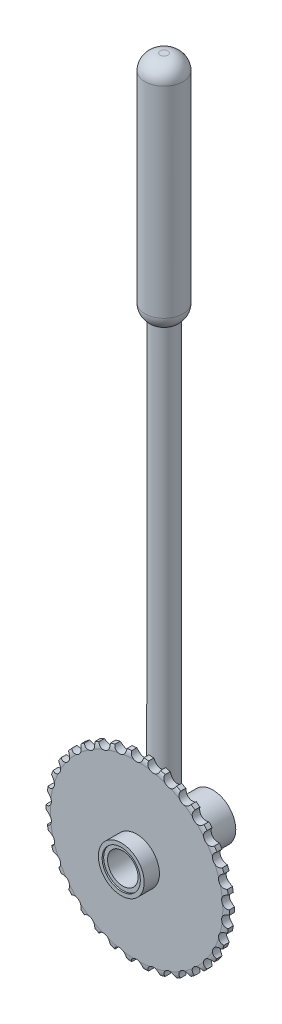
from build123d import *

# Parameters (mm, degrees)
SKETCH1_R           = 15
EXTRUDE1_DEPTH      = 60
SKETCH2_R           = 60
EXTRUDE2_DEPTH      = 5
SKETCH3_R           = 8
BOSS_EXTRUDE1_DEPTH = 449
SKETCH4_R           = 12.5
BOSS_EXTRUDE2_DEPTH = 150
FILLET2_R           = 10
FILLET3_R           = 10
SKETCH5_R           = 10
CUT_EXTRUDE1_DEPTH  = 60
SKETCH6_R           = 12.5
CUT_EXTRUDE2_DEPTH  = 1
SKETCH7_R           = 4
CUT_EXTRUDE3_DEPTH  = 5


with BuildPart() as part:
    # Sketch1 → Extrude1 (new body)
    with BuildSketch(Plane.XY):
        Circle(SKETCH1_R)
    extrude(amount=-EXTRUDE1_DEPTH)

    # Sketch2 → Extrude2 (add)
    with BuildSketch(Plane.XY.offset(-10)):
        Circle(SKETCH2_R)
    extrude(amount=-EXTRUDE2_DEPTH)

    # Sketch3 → Boss-Extrude1 (add)
    with BuildSketch(Plane(origin=(0, 0, 0), x_dir=(1, 0, 0), z_dir=(0, 1, 0))):
        with Locations(Location((0, 28, 0), (0, 0, 90))):
            Circle(SKETCH3_R)
    extrude(amount=BOSS_EXTRUDE1_DEPTH)

    # Sketch4 → Boss-Extrude2 (add)
    with BuildSketch(Plane(origin=(0, 449, 0), x_dir=(1, 0, 0), z_dir=(0, 1, 0))):
        with Locations(Location((0, 28, 0), (0, 0, 270))):
            Circle(SKETCH4_R)
    extrude(amount=-BOSS_EXTRUDE2_DEPTH)

    # Fillet2
    fillet2_edges = [part.edges().sort_by_distance(p)[0] for p in [
        (0, 449, -40.5),
    ]]
    fillet(fillet2_edges, radius=FILLET2_R)

    # Fillet3
    # the kernel refuses this fillet: 10 mm, written as the material it takes off along each edge
    with BuildSketch(Plane(origin=(0, 299, -28), x_dir=(0, 0, 1), z_dir=(-1, 0, 0))) as fillet3_piece_1:
        with BuildLine():
            CenterArc((2.5, 8.351646544), FILLET3_R, 303.367012969, 56.632987031)
            Line((8, 0), (8.11, -0.167032931))
            ThreePointArc((8.11, -0.167032931), (10.25, -0.2), (12.5, -0.2))
            Line((12.5, -0.2), (12.7, 0))
            Line((12.7, 0), (12.7, 8.351646544))
            Line((12.7, 8.351646544), (12.5, 8.351646544))
        make_face()
    revolve(axis=Axis((0, 299, -28), (0, 1, 0)), mode=Mode.SUBTRACT)

    # Sketch5 → Cut-Extrude1 (cut)
    with BuildSketch(Plane.XY):
        Circle(SKETCH5_R)
    extrude(amount=-CUT_EXTRUDE1_DEPTH, mode=Mode.SUBTRACT)

    # Sketch6 → Cut-Extrude2 (cut)
    with BuildSketch(Plane.XY):
        Circle(SKETCH6_R)
    extrude(amount=-CUT_EXTRUDE2_DEPTH, mode=Mode.SUBTRACT)

    # Sketch7 → Cut-Extrude3 (cut)
    with BuildSketch(Plane.XY.offset(-10)):
        with Locations((0, 60)):
            Circle(SKETCH7_R)
        with Locations((11.024971069, 58.978385981)):
            Circle(SKETCH7_R)
        with Locations((21.674499971, 55.948333764)):
            Circle(SKETCH7_R)
        with Locations((31.585929773, 51.013028144)):
            Circle(SKETCH7_R)
        with Locations((40.421738619, 44.340535033)):
            Circle(SKETCH7_R)
        with Locations((47.881033637, 36.158078183)):
            Circle(SKETCH7_R)
        with Locations((53.709797481, 26.744301347)):
            Circle(SKETCH7_R)
        with Locations((57.70953859, 16.419779404)):
            Circle(SKETCH7_R)
        with Locations((59.744050578, 5.536101568)):
            Circle(SKETCH7_R)
        with Locations((59.744050578, -5.536101568)):
            Circle(SKETCH7_R)
        with Locations((57.70953859, -16.419779404)):
            Circle(SKETCH7_R)
        with Locations((53.709797481, -26.744301347)):
            Circle(SKETCH7_R)
        with Locations((47.881033637, -36.158078183)):
            Circle(SKETCH7_R)
        with Locations((40.421738619, -44.340535033)):
            Circle(SKETCH7_R)
        with Locations((31.585929773, -51.013028144)):
            Circle(SKETCH7_R)
        with Locations((21.674499971, -55.948333764)):
            Circle(SKETCH7_R)
        with Locations((11.024971069, -58.978385981)):
            Circle(SKETCH7_R)
        with Locations((0, -60)):
            Circle(SKETCH7_R)
        with Locations((-11.024971069, -58.978385981)):
            Circle(SKETCH7_R)
        with Locations((-21.674499971, -55.948333764)):
            Circle(SKETCH7_R)
        with Locations((-31.585929773, -51.013028144)):
            Circle(SKETCH7_R)
        with Locations((-40.421738619, -44.340535033)):
            Circle(SKETCH7_R)
        with Locations((-47.881033637, -36.158078183)):
            Circle(SKETCH7_R)
        with Locations((-53.709797481, -26.744301347)):
            Circle(SKETCH7_R)
        with Locations((-57.70953859, -16.419779404)):
            Circle(SKETCH7_R)
        with Locations((-59.744050578, -5.536101568)):
            Circle(SKETCH7_R)
        with Locations((-59.744050578, 5.536101568)):
            Circle(SKETCH7_R)
        with Locations((-57.70953859, 16.419779404)):
            Circle(SKETCH7_R)
        with Locations((-53.709797481, 26.744301347)):
            Circle(SKETCH7_R)
        with Locations((-47.881033637, 36.158078183)):
            Circle(SKETCH7_R)
        with Locations((-40.421738619, 44.340535033)):
            Circle(SKETCH7_R)
        with Locations((-31.585929773, 51.013028144)):
            Circle(SKETCH7_R)
        with Locations((-21.674499971, 55.948333764)):
            Circle(SKETCH7_R)
        with Locations((-11.024971069, 58.978385981)):
            Circle(SKETCH7_R)
    extrude(amount=-CUT_EXTRUDE3_DEPTH, mode=Mode.SUBTRACT)

    # Sketch8 → Cut-Revolve2 (revolve, cut)
    with BuildSketch(Plane(origin=(0, 0, 0), x_dir=(1, 0, 0), z_dir=(0, 1, 0))):
        with BuildLine():
            Line((56.48725152, 15), (56.48725152, 15.720386183))
            Line((56.48725152, 15.720386183), (61.681302501, 15.720386183))
            Line((61.681302501, 15.720386183), (61.681302501, 8.212509047))
            Line((61.681302501, 8.212509047), (56.48725152, 8.212509047))
            Line((56.48725152, 8.212509047), (56.48725152, 10))
            add(Edge.make_bspline(
                [(56.48725152, 10), (61.166023282, 10), (61.166023282, 12.5), (61.166023282, 15), (56.48725152, 15)],
                knots=[4.71238898, 4.71238898, 4.71238898, 6.283185307, 6.283185307, 7.853981634, 7.853981634, 7.853981634], degree=2, weights=[1, 0.707106781, 1, 0.707106781, 1]))
        make_face()
    revolve(axis=Axis((0, 0, -60), (0, 0, 1)), mode=Mode.SUBTRACT)


solid = part.part
